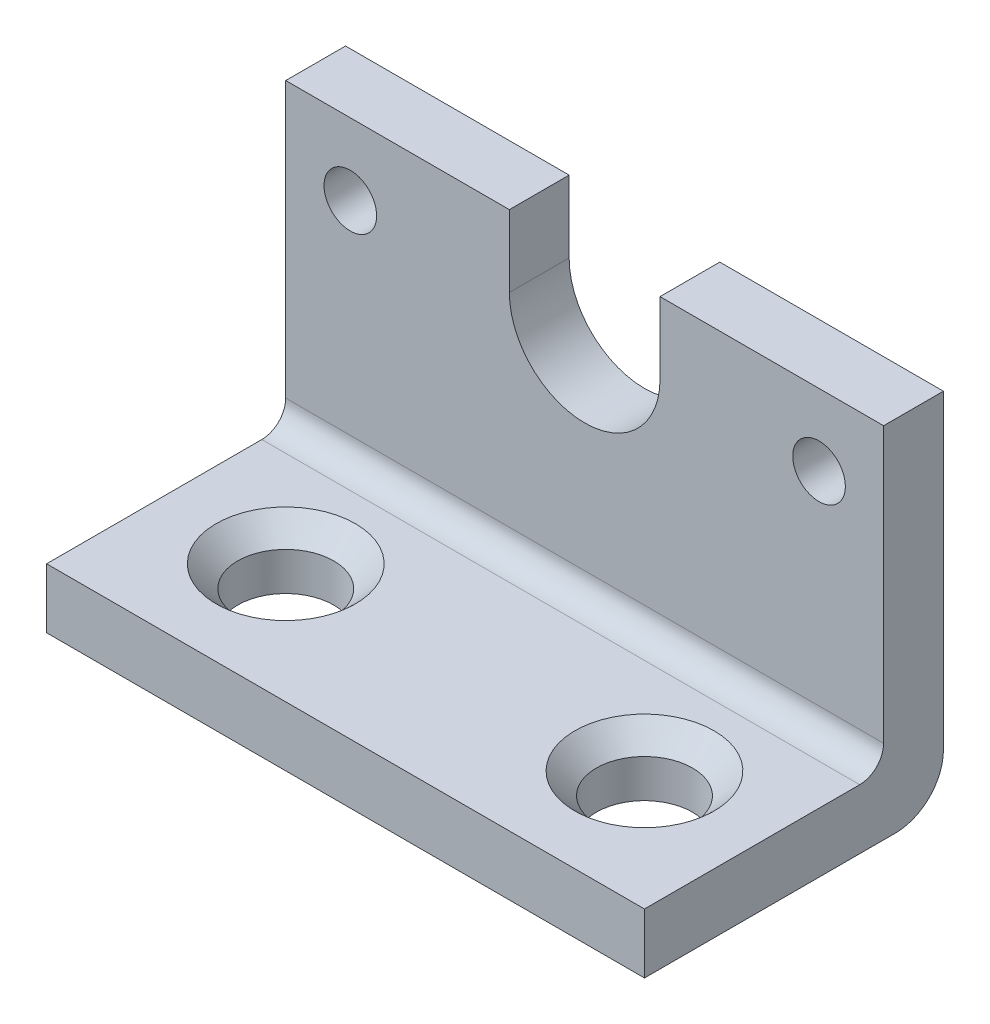
from build123d import *

# Parameters (mm, degrees)
SKETCH1_R           = 1.397
BOSS_EXTRUDE1_DEPTH = 3.175
SKETCH2_W           = 31.75
SKETCH2_H           = 12.7
SKETCH2_R           = 2.5527
BOSS_EXTRUDE2_DEPTH = 3.175
FILLET1_R           = 1.27
FILLET2_R           = 2.54
CHAMFER1_SIZE       = 1.143


with BuildPart() as part:
    # Sketch1 → Boss-Extrude1 (new body)
    with BuildSketch(Plane.XY):
        with BuildLine():
            Line((-4.0005, 15.24), (-4.0005, 19.05))
            Line((-4.0005, 19.05), (-15.875, 19.05))
            Line((-15.875, 19.05), (-15.875, 0))
            Line((-15.875, 0), (15.875, 0))
            Line((15.875, 0), (15.875, 19.05))
            Line((15.875, 19.05), (4.0005, 19.05))
            Line((4.0005, 19.05), (4.0005, 15.24))
            ThreePointArc((4.0005, 15.24), (0, 11.2395), (-4.0005, 15.24))
        make_face()
        with Locations((12.446, 15.24)):
            Circle(SKETCH1_R, mode=Mode.SUBTRACT)
        with Locations((-12.446, 15.24)):
            Circle(SKETCH1_R, mode=Mode.SUBTRACT)
    extrude(amount=-BOSS_EXTRUDE1_DEPTH)

    # Sketch2 → Boss-Extrude2 (add)
    with BuildSketch(Plane(origin=(0, 0, 0), x_dir=(1, 0, 0), z_dir=(0, 1, 0))):
        with Locations((0, -6.35)):
            Rectangle(SKETCH2_W, SKETCH2_H)
        with Locations((-9.525, -6.35)):
            Circle(SKETCH2_R, mode=Mode.SUBTRACT)
        with Locations((9.525, -6.35)):
            Circle(SKETCH2_R, mode=Mode.SUBTRACT)
    extrude(amount=BOSS_EXTRUDE2_DEPTH)

    # Fillet1
    fillet1_edges = [part.edges().sort_by_distance(p)[0] for p in [
        (0, 3.175, 0),
    ]]
    fillet(fillet1_edges, radius=FILLET1_R)

    # Fillet2
    fillet2_edges = [part.edges().sort_by_distance(p)[0] for p in [
        (0, 0, -3.175),
    ]]
    fillet(fillet2_edges, radius=FILLET2_R)

    # Chamfer1
    chamfer1_edges = [part.edges().sort_by_distance(p)[0] for p in [
        (-12.0777, 3.175, 6.35),
        (6.9723, 3.175, 6.35),
    ]]
    chamfer(chamfer1_edges, length=CHAMFER1_SIZE)


solid = part.part
